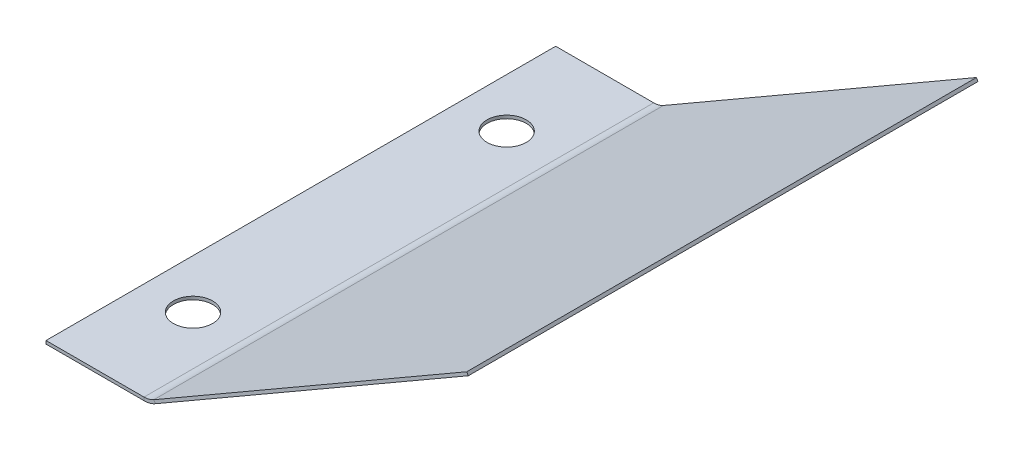
from build123d import *

# Parameters (mm, degrees)
SKETCH2_W                   = 15.875
SKETCH2_H                   = 82.55
BOSS_EXTRUDE2_DEPTH         = 0.508
EDGE_FLANGE2_DEPTH          = 82.55
F_1_4_0_25_DIAMETER_HOLE1_D = 6.35


# Sheet-metal steps are written as plain solids
with BuildPart() as part:
    # Sketch2 → Boss-Extrude2 (new body)
    with BuildSketch(Plane(origin=(0, 0, 0), x_dir=(1, 0, 0), z_dir=(0, 1, 0))):
        with Locations((-7.9375, 41.275)):
            Rectangle(SKETCH2_W, SKETCH2_H)
    extrude(amount=BOSS_EXTRUDE2_DEPTH)

    # Edge-Flange2 section (across the edge) → Edge-Flange2 (add)
    with BuildSketch(Plane(origin=(0.850738686, 0.508, 0), x_dir=(-0.49999999999999495, 0.8660254037844416, 0), z_dir=(0, 0, -1))):
        with BuildLine():
            Line((-0.508, 0.850738686), (-0.508, 59.380374))
            Line((-0.508, 59.380374), (0, 59.380374))
            Line((0, 59.380374), (0, 0.850738686))
            ThreePointArc((0, 0.850738686), (0.108185502, 0.028988218), (0.425369343, -0.736761314))
            Line((0.425369343, -0.736761314), (-0.014571562, -0.990761314))
            ThreePointArc((-0.014571562, -0.990761314), (-0.382504818, -0.102491857), (-0.508, 0.850738686))
        make_face()
    extrude(amount=EDGE_FLANGE2_DEPTH)

    # 1/4 (0.25) Diameter Hole1 (through all)
    with Locations(Plane(origin=(0, 0, 0), x_dir=(-1, 0, 0), z_dir=(0, -1, 0))):
        with Locations((7.9375, 15.875), (7.9375, 66.675)):
            Hole(F_1_4_0_25_DIAMETER_HOLE1_D / 2)


solid = part.part
